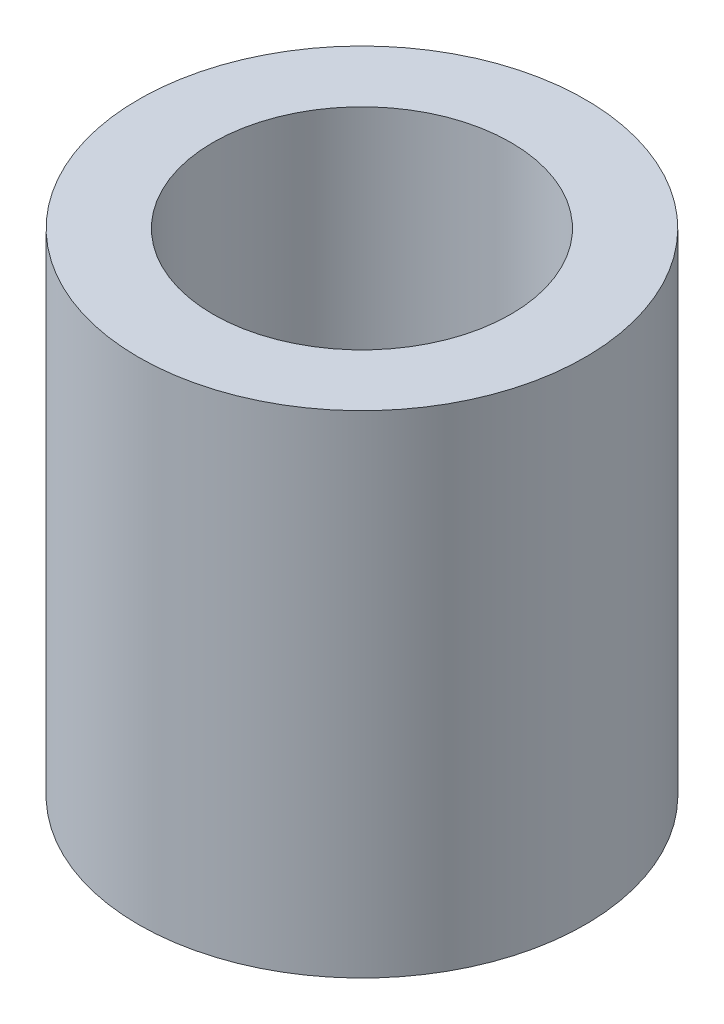
from build123d import *

# Parameters (mm, degrees)
ESBO_O2_R                = 1.5
ESBO_O2_R_2              = 1
RESSALTO_EXTRUS_O1_DEPTH = 3.3


with BuildPart() as part:
    # Esboço2 → Ressalto-extrusão1 (new body)
    with BuildSketch(Plane(origin=(0, 0, 0), x_dir=(1, 0, 0), z_dir=(0, 1, 0))):
        Circle(ESBO_O2_R)
        Circle(ESBO_O2_R_2, mode=Mode.SUBTRACT)
    extrude(amount=RESSALTO_EXTRUS_O1_DEPTH)


solid = part.part
